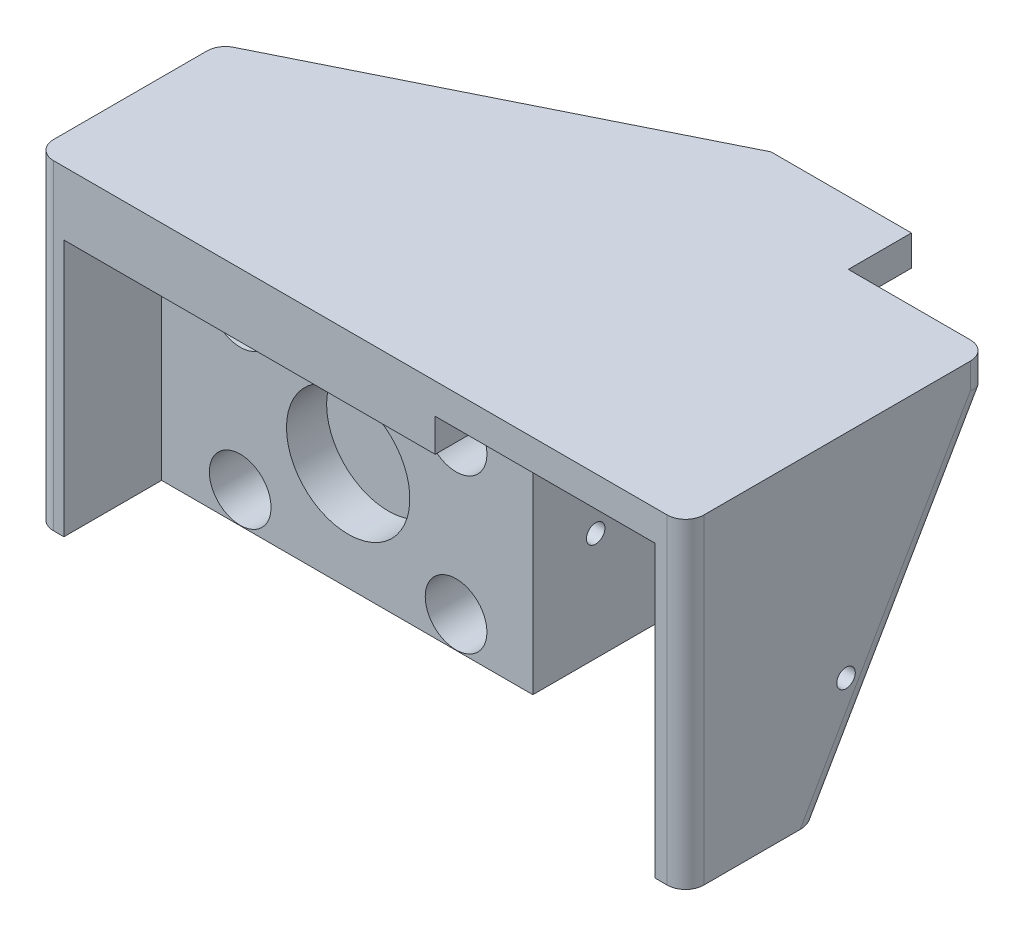
from build123d import *

# Parameters (mm, degrees)
CROQUIS1_W              = 65.5
CROQUIS1_H              = 52.5
SALIENTE_EXTRUIR1_DEPTH = 30
CROQUIS2_W              = 60.8
CROQUIS2_H              = 42.1
CORTAR_EXTRUIR1_DEPTH   = 16
CROQUIS3_W              = 5
CROQUIS3_H              = 52.5
SALIENTE_EXTRUIR2_DEPTH = 30
CROQUIS4_W              = 60
CROQUIS4_H              = 5
SALIENTE_EXTRUIR3_DEPTH = 30
CROQUIS5_R              = 10.1
CORTAR_EXTRUIR2_DEPTH   = 6.57
CROQUIS7_R              = 5.05
CORTAR_EXTRUIR3_DEPTH   = 8.59
CROQUIS8_R              = 2.275
CORTAR_EXTRUIR4_DEPTH   = 8.59
CROQUIS9_W              = 60.5
CROQUIS9_H              = 30
SALIENTE_EXTRUIR4_DEPTH = 5
CORTAR_EXTRUIR5_DEPTH   = 5
CROQUIS11_W             = 41
CROQUIS11_H             = 60
SALIENTE_EXTRUIR5_DEPTH = 5
CROQUIS12_W             = 5
CROQUIS12_H             = 60
SALIENTE_EXTRUIR6_DEPTH = 47.5
CROQUIS13_W             = 18
CROQUIS13_H             = 10.34
CORTAR_EXTRUIR6_DEPTH   = 10
CROQUIS14_W             = 17.194416488
CROQUIS14_H             = 64.089157204
CORTAR_EXTRUIR7_DEPTH   = 10
CORTAR_EXTRUIR8_DEPTH   = 10
REDONDEO1_R             = 3
REDONDEO6_R             = 3
REDONDEO7_R             = 3
CAVIDAD1_START          = -32.75
CAVIDAD1_DEPTH          = 5
CROQUIS16_R             = 1.5
CORTAR_EXTRUIR10_DEPTH  = 10
CAVIDAD3_START          = -73.75
CAVIDAD3_OUTLINE_R      = 1.515
CAVIDAD3_DEPTH          = 106.5
CROQUIS17_R             = 3
CORTAR_EXTRUIR11_DEPTH  = 5
REDONDEO8_R             = 3
REDONDEO9_R             = 3


# Read off the part's stored shape, not the designer's step: Cavidad1, Cavidad3
with BuildPart() as part:
    # Croquis1 → Saliente-Extruir1 (new body)
    with BuildSketch(Plane.XY):
        Rectangle(CROQUIS1_W, CROQUIS1_H)
    extrude(amount=-SALIENTE_EXTRUIR1_DEPTH)

    # Croquis2 → Cortar-Extruir1 (cut)
    with BuildSketch(Plane.XY):
        with Locations((-2.35, -5.2)):
            Rectangle(CROQUIS2_W, CROQUIS2_H)
    extrude(amount=-CORTAR_EXTRUIR1_DEPTH, mode=Mode.SUBTRACT)

    # Croquis3 → Saliente-Extruir2 (add)
    with BuildSketch(Plane(origin=(0, 0, -30), x_dir=(-1, 0, 0), z_dir=(0, 0, -1))):
        with Locations((30.25, 0)):
            Rectangle(CROQUIS3_W, CROQUIS3_H)
    extrude(amount=SALIENTE_EXTRUIR2_DEPTH)

    # Croquis4 → Saliente-Extruir3 (add)
    with BuildSketch(Plane.ZY.offset(32.75)):
        with Locations((-30, 23.75)):
            Rectangle(CROQUIS4_W, CROQUIS4_H)
    extrude(amount=SALIENTE_EXTRUIR3_DEPTH)

    # Croquis5 → Cortar-Extruir2 (cut)
    with BuildSketch(Plane.XY.offset(-16)):
        with Locations((-2.5, -8.51)):
            Circle(CROQUIS5_R)
    extrude(amount=-CORTAR_EXTRUIR2_DEPTH, mode=Mode.SUBTRACT)

    # Croquis7 → Cortar-Extruir3 (cut)
    with BuildSketch(Plane.XY.offset(-16)):
        with Locations((-20.17, 4.12)):
            Circle(CROQUIS7_R)
        with Locations((15.18, 4.12)):
            Circle(CROQUIS7_R)
        with Locations((15.18, -21.13)):
            Circle(CROQUIS7_R)
        with Locations((-20.17, -21.13)):
            Circle(CROQUIS7_R)
    extrude(amount=-CORTAR_EXTRUIR3_DEPTH, mode=Mode.SUBTRACT)

    # Croquis8 → Cortar-Extruir4 (cut)
    with BuildSketch(Plane.XY.offset(-24.59)):
        with Locations((-20.17, 4.12)):
            Circle(CROQUIS8_R)
        with Locations((-20.17, -21.13)):
            Circle(CROQUIS8_R)
        with Locations((15.18, 4.12)):
            Circle(CROQUIS8_R)
        with Locations((15.18, -21.13)):
            Circle(CROQUIS8_R)
    extrude(amount=-CORTAR_EXTRUIR4_DEPTH, mode=Mode.SUBTRACT)

    # Croquis9 → Saliente-Extruir4 (add)
    with BuildSketch(Plane(origin=(0, 26.25, 0), x_dir=(1, 0, 0), z_dir=(0, 1, 0))):
        with Locations((2.5, 45)):
            Rectangle(CROQUIS9_W, CROQUIS9_H)
    extrude(amount=-SALIENTE_EXTRUIR4_DEPTH)

    # Croquis10 → Cortar-Extruir5 (cut)
    with BuildSketch(Plane.XZ.offset(-21.25)):
        Polygon((32.75, -30), (-27.75, -60), (-30.096630242, -66.962952029), (62.11742193, -82.705107475), (54.436655983, -30), align=None)
    extrude(amount=-CORTAR_EXTRUIR5_DEPTH, mode=Mode.SUBTRACT)

    # Croquis11 → Saliente-Extruir5 (add)
    with BuildSketch(Plane.XZ.offset(-21.25)):
        with Locations((-53.25, -30)):
            Rectangle(CROQUIS11_W, CROQUIS11_H)
    extrude(amount=-SALIENTE_EXTRUIR5_DEPTH)

    # Croquis12 → Saliente-Extruir6 (add)
    with BuildSketch(Plane.XZ.offset(-21.25)):
        with Locations((-71.25, -30)):
            Rectangle(CROQUIS12_W, CROQUIS12_H)
    extrude(amount=SALIENTE_EXTRUIR6_DEPTH)

    # Croquis13 → Cortar-Extruir6 (cut)
    with BuildSketch(Plane.XZ.offset(-21.25)):
        with Locations((-59.75, -54.83)):
            Rectangle(CROQUIS13_W, CROQUIS13_H)
    extrude(amount=-CORTAR_EXTRUIR6_DEPTH, mode=Mode.SUBTRACT)

    # Croquis14 → Cortar-Extruir7 (cut)
    with BuildSketch(Plane(origin=(-68.75, 0, 0), x_dir=(0, 0, -1), z_dir=(1, 0, 0))):
        with Locations((58.257208244, -5.794578602)):
            Rectangle(CROQUIS14_W, CROQUIS14_H)
    extrude(amount=-CORTAR_EXTRUIR7_DEPTH, mode=Mode.SUBTRACT)

    # Croquis15 → Cortar-Extruir8 (cut)
    with BuildSketch(Plane(origin=(-68.75, 0, 0), x_dir=(0, 0, -1), z_dir=(1, 0, 0))):
        Polygon((15.02, -38.75), (49.66, 21.25), (49.66, -38.75), align=None)
    extrude(amount=-CORTAR_EXTRUIR8_DEPTH, mode=Mode.SUBTRACT)

    # Redondeo1
    redondeo1_edges = [part.edges().sort_by_distance(p)[0] for p in [
        (32.75, 0, 0),
    ]]
    fillet(redondeo1_edges, radius=REDONDEO1_R)

    # Redondeo6
    redondeo6_edges = [part.edges().sort_by_distance(p)[0] for p in [
        (32.75, -2.5, -30),
    ]]
    fillet(redondeo6_edges, radius=REDONDEO6_R)

    # Redondeo7
    redondeo7_edges = [part.edges().sort_by_distance(p)[0] for p in [
        (32.75, 23.75, -30),
    ]]
    fillet(redondeo7_edges, radius=REDONDEO7_R)

    # Cavidad1 outline → Cavidad1 (cut)
    with BuildSketch(Plane.YZ.offset(CAVIDAD1_START)):
        with BuildLine():
            ThreePointArc((5.82457056, -60), (-8.75, -50.820508076), (-23.32457056, -60))
            Line((-23.32457056, -60), (5.82457056, -60))
        make_face()
    extrude(amount=CAVIDAD1_DEPTH, mode=Mode.SUBTRACT)

    # Croquis16 → Cortar-Extruir10 (cut)
    with BuildSketch(Plane.ZY.offset(-28.05)):
        with Locations((-26.285, -8.51)):
            Circle(CROQUIS16_R)
    extrude(amount=-CORTAR_EXTRUIR10_DEPTH, mode=Mode.SUBTRACT)

    # Cavidad3 outline → Cavidad3 (cut)
    with BuildSketch(Plane.YZ.offset(CAVIDAD3_START)):
        with Locations((-8.51, -26.285)):
            Circle(CAVIDAD3_OUTLINE_R)
    extrude(amount=CAVIDAD3_DEPTH, mode=Mode.SUBTRACT)

    # Croquis17 → Cortar-Extruir11 (cut)
    with BuildSketch(Plane(origin=(32.75, 0, 0), x_dir=(0, 0, -1), z_dir=(1, 0, 0))):
        with Locations(Location((26.285, -8.51, 0), (0, 0, 90))):
            Circle(CROQUIS17_R)
    extrude(amount=-CORTAR_EXTRUIR11_DEPTH, mode=Mode.SUBTRACT)

    # Redondeo8
    redondeo8_edges = [part.edges().sort_by_distance(p)[0] for p in [
        (-73.75, 0, 0),
    ]]
    fillet(redondeo8_edges, radius=REDONDEO8_R)

    # Redondeo9
    redondeo9_edges = [part.edges().sort_by_distance(p)[0] for p in [
        (-73.75, 23.75, -49.66),
        (-73.75, -2.5, -35.948333333),
    ]]
    fillet(redondeo9_edges, radius=REDONDEO9_R)


with BuildPart() as body_2:
    # Simetría1: mirrored copy
    add(part.part.mirror(Plane(origin=(-73.75, 26.25, 0), x_dir=(0, 0, 1), z_dir=(-1, 0, 0))))


solid = body_2.part
